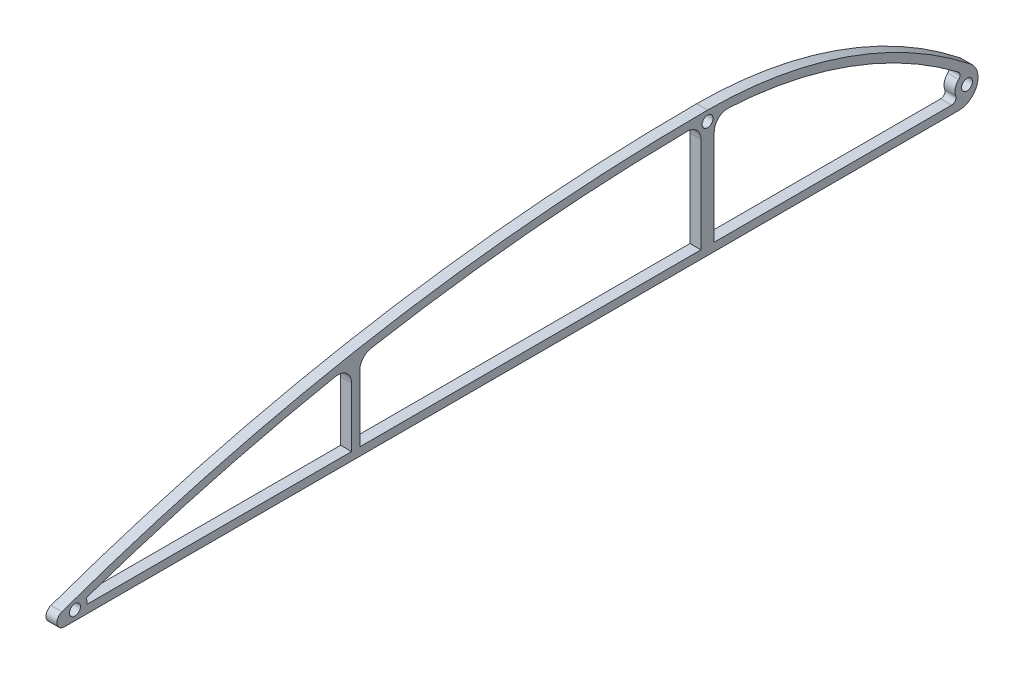
from build123d import *

# Parameters (mm, degrees)
BOSS_EXTRU_1_DEPTH      = 2
ESQUISSE4_R             = 1
ENL_V_MAT_EXTRU_2_DEPTH = 176.894862906
ENL_V_MAT_EXTRU_3_DEPTH = 4
CONG_2_R                = 1.35
CONG_3_R                = 2.5
CONG_4_R                = 0.8


with BuildPart() as part:
    # Esquisse2 → Boss.-Extru.1 (new body)
    with BuildSketch(Plane(origin=(0, 0, 0), x_dir=(0, 0, -1), z_dir=(1, 0, 0))):
        with BuildLine():
            Line((0, 0), (170.873171093, 0))
            ThreePointArc((170.873171093, 0), (174.177922559, 2.347343181), (173.049882129, 6.240789861))
            ThreePointArc((173.049882129, 6.240789861), (150.444362328, 18.689979585), (125, 23))
            ThreePointArc((125, 23), (61.450806457, 17.202138822), (0, 0))
        make_face()
    extrude(amount=BOSS_EXTRU_1_DEPTH)

    # Esquisse4 → Enlèv. mat.-Extru.2 (cut, through all)
    with BuildSketch(Plane(origin=(2, 0, 0), x_dir=(0, 0, -1), z_dir=(1, 0, 0))):
        with Locations((125, 21.2)):
            Circle(ESQUISSE4_R)
        with Locations((172.368958832, 3.328337296)):
            Circle(ESQUISSE4_R)
        with Locations((9.5, 1.731368161)):
            Circle(ESQUISSE4_R)
    extrude(amount=-ENL_V_MAT_EXTRU_2_DEPTH, mode=Mode.SUBTRACT)

    # Esquisse9 → Enlèv. mat.-Extru.3 (cut)
    with BuildSketch(Plane(origin=(0, 0, 0), x_dir=(0, 0, -1), z_dir=(1, 0, 0))):
        with BuildLine():
            Line((126.213985158, 1.5), (171.145364646, 1.5))
            ThreePointArc((171.145364646, 1.5), (170.189330871, 3.62703774), (171.682356852, 5.418451581))
            ThreePointArc((171.682356852, 5.418451581), (150.261670587, 17.172398685), (126.213985158, 21.497892659))
            Line((126.213985158, 21.497892659), (126.213985158, 1.5))
        make_face()
        with BuildLine():
            Line((11.687799985, 1.5), (60, 1.5))
            Line((60, 1.5), (60, 15.405547145))
            ThreePointArc((60, 15.405547145), (35.535152821, 9.861420291), (11.530732115, 2.577611078))
            ThreePointArc((11.530732115, 2.577611078), (11.676996711, 2.048677664), (11.687799985, 1.5))
        make_face()
        with BuildLine():
            Line((61.5, 1.5), (123.786014842, 1.5))
            Line((123.786014842, 1.5), (123.786014842, 21.497892659))
            ThreePointArc((123.786014842, 21.497892659), (92.512776663, 19.987580782), (61.5, 15.685935533))
            Line((61.5, 15.685935533), (61.5, 1.5))
        make_face()
    extrude(amount=ENL_V_MAT_EXTRU_3_DEPTH, mode=Mode.SUBTRACT)

    # Congé2
    cong_2_edges = [part.edges().sort_by_distance(p)[0] for p in [
        (1, 0, 0),
    ]]
    fillet(cong_2_edges, radius=CONG_2_R)

    # Congé3
    cong_3_edges = [part.edges().sort_by_distance(p)[0] for p in [
        (1, 21.497892659, -126.213985158),
        (1, 21.497892659, -123.786014842),
        (1, 15.405547145, -60),
        (1, 15.685935533, -61.5),
    ]]
    fillet(cong_3_edges, radius=CONG_3_R)

    # Congé4
    cong_4_edges = [part.edges().sort_by_distance(p)[0] for p in [
        (1, 1.5, -171.145364646),
        (1, 5.418451581, -171.682356852),
    ]]
    fillet(cong_4_edges, radius=CONG_4_R)


solid = part.part
